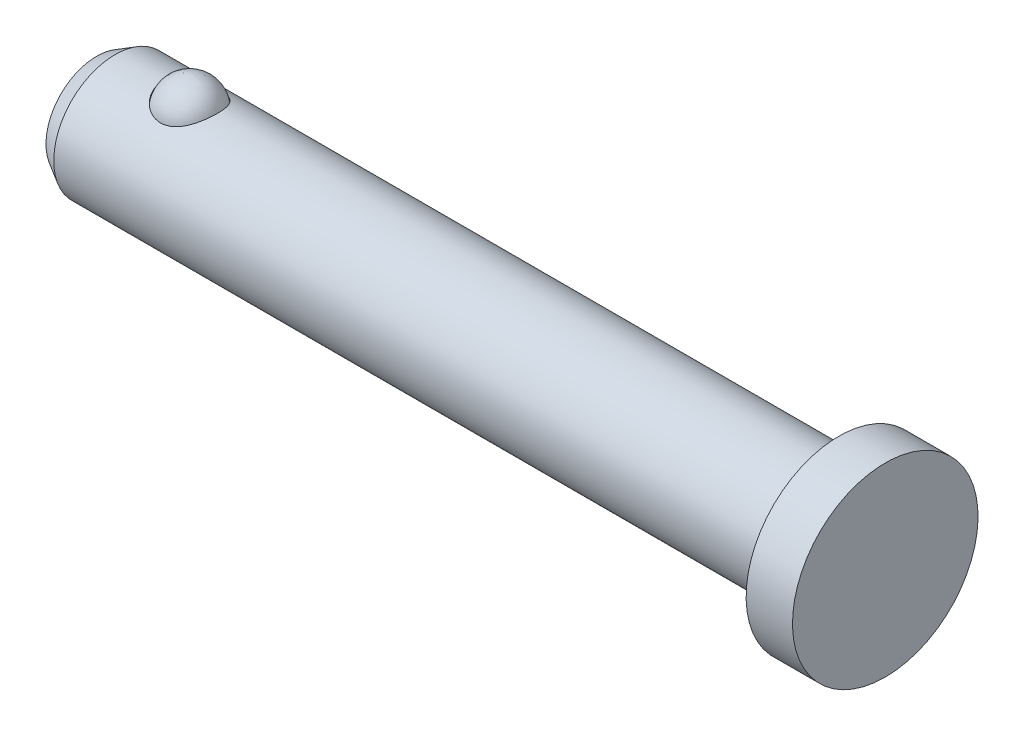
from build123d import *


with BuildPart() as part:
    # Sketch1 → Revolve1 (revolve)
    with BuildSketch(Plane.XY):
        Polygon((20.240625, 4.7625), (17.859375, 4.7625), (17.859375, 3.1496), (-19.295745, 3.1496), (-20.240625, 2.604073278), (-20.240625, 0), (20.240625, 0), align=None)
    revolve(axis=Axis((-20.240625, 0, 0), (1, 0, 0)))

    # Sketch2 → Cut-Revolve1 (revolve, cut)
    with BuildSketch(Plane.XY):
        with BuildLine():
            Line((-13.961791201, 2.636566201), (-16.969058799, 2.636566201))
            ThreePointArc((-16.969058799, 2.636566201), (-15.465425, 4.1402), (-13.961791201, 2.636566201))
        make_face()
    revolve(axis=Axis((-13.961791201, 2.636566201, 0), (1, 0, 0)), mode=Mode.SUBTRACT)


with BuildPart() as body_2:
    # Sketch3 → Revolve2 (revolve)
    with BuildSketch(Plane.XY):
        with BuildLine():
            Line((-13.987191201, 2.636566201), (-16.943658799, 2.636566201))
            ThreePointArc((-16.943658799, 2.636566201), (-15.465425, 4.1148), (-13.987191201, 2.636566201))
        make_face()
    revolve(axis=Axis((-13.987191201, 2.636566201, 0), (1, 0, 0)))


solid = Compound([part.part, body_2.part])
